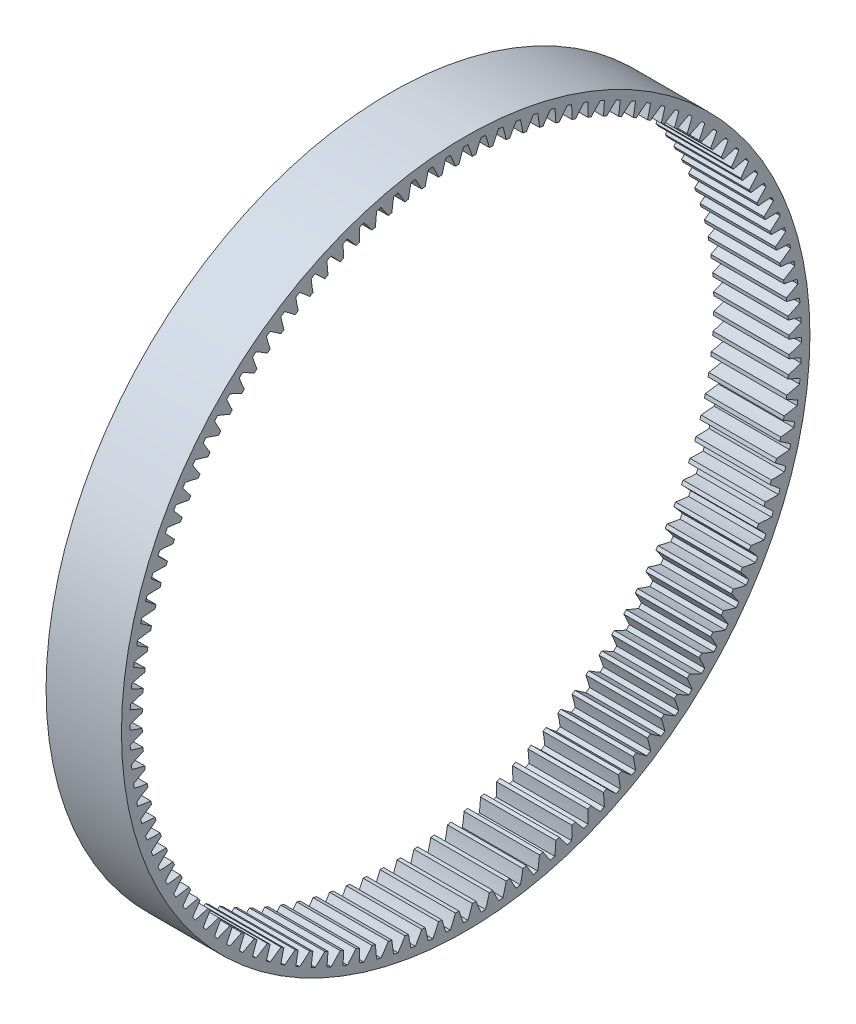
from build123d import *

# Parameters (mm, degrees)
BASPROSKE_W         = 6
BASPROSKE_H         = 2.2764
TOOTHCUT_DEPTH      = 87.865380871
TEETHCUTS_COUNT     = 120
TEETHCUTS_ANGLE     = 357
SKETCH1_R           = 62.7764
SKETCH1_R_2         = 61.2764
BOSS_EXTRUDE1_DEPTH = 6
SKETCH3_R           = 62.7764
BOSS_EXTRUDE2_DEPTH = 7.75


with BuildPart() as part:
    # BasProSke → Base-Revolve (revolve)
    with BuildSketch(Plane(origin=(0, 0, 0), x_dir=(1, 0, 0), z_dir=(0, 1, 0)), mode=Mode.PRIVATE) as base_revolve_sk:
        with Locations((3, 60.1382)):
            Rectangle(BASPROSKE_W, BASPROSKE_H)
    revolve(base_revolve_sk.sketch.rotate(Axis((-10, 0, 0), (1, 0, 0)), 180), axis=Axis((-10, 0, 0), (1, 0, 0)))

    # TooCutSke → ToothCut (cut, through all)
    with BuildSketch(Plane(origin=(0, 0, 0), x_dir=(0, 0, -1), z_dir=(1, 0, 0))):
        with BuildLine():
            ThreePointArc((1.222221041, 58.96193366), (0.837717971, 60.114045071), (0.406895219, 61.249648467))
            ThreePointArc((0.406895219, 61.249648467), (0, 61.251), (-0.406895219, 61.249648467))
            ThreePointArc((-0.406895219, 61.249648467), (-0.837717971, 60.114045071), (-1.222221041, 58.96193366))
            ThreePointArc((-1.222221041, 58.96193366), (0, 58.9746), (1.222221041, 58.96193366))
        make_face()
    toothcut = extrude(amount=TOOTHCUT_DEPTH, mode=Mode.SUBTRACT)

    # TeethCuts: ToothCut ×120 about axis
    teethcuts_axis = Axis((-10, 0, 0), (1, 0, 0))
    for i in range(1, TEETHCUTS_COUNT):
        add(toothcut.rotate(teethcuts_axis, i * TEETHCUTS_ANGLE / (TEETHCUTS_COUNT - 1)), mode=Mode.SUBTRACT)

    # Sketch1 → Boss-Extrude1 (add)
    with BuildSketch(Plane(origin=(6, 0, 0), x_dir=(0, 0, -1), z_dir=(1, 0, 0))):
        Circle(SKETCH1_R)
        Circle(SKETCH1_R_2, mode=Mode.SUBTRACT)
    extrude(amount=-BOSS_EXTRUDE1_DEPTH)

    # Sketch3 → Boss-Extrude2 (add)
    with BuildSketch(Plane.ZY):
        with Locations(Location((0, 0, 0), (0, 0, 180))):
            Circle(SKETCH3_R)
        with BuildLine():
            ThreePointArc((-1.874585183, 58.970212229), (-2.314708924, 60.0878651), (-2.799221339, 61.187003202))
            ThreePointArc((-2.799221339, 61.187003202), (-3.205629656, 61.167057633), (-3.611896506, 61.144412702))
            ThreePointArc((-3.611896506, 61.144412702), (-3.978863493, 60.000650455), (-4.299749654, 58.843114745))
            ThreePointArc((-4.299749654, 58.843114745), (-4.629086648, 58.81812269), (-4.958278576, 58.791287395))
            ThreePointArc((-4.958278576, 58.791287395), (-5.456292575, 59.884374265), (-5.997665425, 60.956648616))
            ThreePointArc((-5.997665425, 60.956648616), (-6.402472904, 60.915460613), (-6.806997835, 60.871584352))
            ThreePointArc((-6.806997835, 60.871584352), (-7.113602016, 59.710184023), (-7.373467675, 58.537440792))
            ThreePointArc((-7.373467675, 58.537440792), (-7.701045341, 58.495246821), (-8.028381672, 58.451219728))
            ThreePointArc((-8.028381672, 58.451219728), (-8.582920906, 59.516744521), (-9.179670328, 60.559216092))
            ThreePointArc((-9.179670328, 60.559216092), (-9.581767418, 60.49689855), (-9.983441656, 60.43191122))
            ThreePointArc((-9.983441656, 60.43191122), (-10.22884265, 59.256056127), (-10.426975533, 58.071319782))
            ThreePointArc((-10.426975533, 58.071319782), (-10.751896004, 58.012039546), (-11.076479532, 57.950941331))
            ThreePointArc((-11.076479532, 57.950941331), (-11.686024049, 58.985983519), (-12.336514392, 59.995794966))
            ThreePointArc((-12.336514392, 59.995794966), (-12.734798974, 59.912518693), (-13.132521557, 59.82659842))
            ThreePointArc((-13.132521557, 59.82659842), (-13.316046737, 58.6395115), (-13.451903777, 57.446029321))
            ThreePointArc((-13.451903777, 57.446029321), (-13.773276467, 57.369825303), (-14.094217532, 57.291823432))
            ThreePointArc((-14.094217532, 57.291823432), (-14.757096611, 58.293546035), (-15.459544928, 59.267929537))
            ThreePointArc((-15.459544928, 59.267929537), (-15.852925332, 59.163922786), (-16.24560613, 59.057305073))
            ThreePointArc((-16.24560613, 59.057305073), (-16.366752466, 57.862240049), (-16.439961287, 56.663283287))
            ThreePointArc((-16.439961287, 56.663283287), (-16.756905338, 56.570364357), (-17.073324261, 56.475672627))
            ThreePointArc((-17.073324261, 56.475672627), (-17.787720998, 57.441329994), (-18.540201926, 58.377614833))
            ThreePointArc((-18.540201926, 58.377614833), (-18.927599922, 58.25316268), (-19.314162625, 58.126139757))
            ThreePointArc((-19.314162625, 58.126139757), (-19.372598064, 56.926372219), (-19.382958006, 55.725227132))
            ThreePointArc((-19.382958006, 55.725227132), (-19.694604695, 55.615847974), (-20.005634195, 55.504725929))
            ThreePointArc((-20.005634195, 55.504725929), (-20.769590477, 56.431671259), (-21.570041519, 57.327291144))
            ThreePointArc((-21.570041519, 57.327291144), (-21.950395278, 57.182734703), (-22.329780344, 57.035654733))
            ThreePointArc((-22.329780344, 57.035654733), (-22.325344717, 55.834473159), (-22.272827385, 54.634432003))
            ThreePointArc((-22.272827385, 54.634432003), (-22.57832251, 54.508892418), (-22.883110076, 54.381644636))
            ThreePointArc((-22.883110076, 54.381644636), (-23.694531953, 55.267337237), (-24.540759128, 56.119837334))
            ThreePointArc((-24.540759128, 56.119837334), (-24.913026125, 55.955572826), (-25.284193686, 55.788838943))
            ThreePointArc((-25.284193686, 55.788838943), (-25.216899152, 54.58953569), (-25.101648492, 53.393887693))
            ThreePointArc((-25.101648492, 53.393887693), (-25.400154712, 53.252531777), (-25.697864943, 53.109507034))
            ThreePointArc((-25.697864943, 53.109507034), (-26.554528364, 53.951519284), (-27.444212221, 54.758562952))
            ThreePointArc((-27.444212221, 54.758562952), (-27.8073721, 54.575040613), (-28.169304811, 54.389109824))
            ThreePointArc((-28.169304811, 54.389109824), (-28.039335819, 53.194972098), (-27.861667725, 52.006994449))
            ThreePointArc((-27.861667725, 52.006994449), (-28.152366855, 51.850209647), (-28.442183748, 51.691799965))
            ThreePointArc((-28.442183748, 51.691799965), (-29.341740658, 52.487823968), (-30.272442637, 53.247199155))
            ThreePointArc((-30.272442637, 53.247199155), (-30.6255, 53.044922007), (-30.97720583, 52.840303935))
            ThreePointArc((-30.97720583, 52.840303935), (-30.784918616, 51.654604785), (-30.545320063, 50.477553648))
            ThreePointArc((-30.545320063, 50.477553648), (-30.827415318, 50.305769697), (-31.108544505, 50.132409266))
            ThreePointArc((-31.108544505, 50.132409266), (-32.048529281, 50.880263174), (-33.017698391, 51.589888485))
            ThreePointArc((-33.017698391, 51.589888485), (-33.359685534, 51.369410957), (-33.70020048, 51.146666446))
            ThreePointArc((-33.70020048, 51.146666446), (-33.446122091, 49.972655791), (-33.145249803, 48.80975738))
            ThreePointArc((-33.145249803, 48.80975738), (-33.417967979, 48.623445129), (-33.689638903, 48.435609117))
            ThreePointArc((-33.689638903, 48.435609117), (-34.667475112, 49.133243116), (-35.672454929, 49.791173518))
            ThreePointArc((-35.672454929, 49.791173518), (-36.002434488, 49.553099922), (-36.330825224, 49.3128395))
            ThreePointArc((-36.330825224, 49.3128395), (-36.01565207, 48.153735221), (-35.654330716, 47.008176961))
            ThreePointArc((-35.654330716, 47.008176961), (-35.916924312, 46.807847077), (-36.178392344, 46.606050331))
            ThreePointArc((-36.178392344, 46.606050331), (-37.191399804, 47.251552253), (-38.229435748, 47.855984405))
            ThreePointArc((-38.229435748, 47.855984405), (-38.546503272, 47.600967285), (-38.861869701, 47.343849488))
            ThreePointArc((-38.861869701, 47.343849488), (-38.48646565, 46.202828609), (-38.065685588, 45.077750396))
            ThreePointArc((-38.065685588, 45.077750396), (-38.317434851, 44.86395197), (-38.567983325, 44.6487476))
            ThreePointArc((-38.567983325, 44.6487476), (-39.613385455, 45.24034817), (-40.681632341, 45.789625365))
            ThreePointArc((-40.681632341, 45.789625365), (-40.98491877, 45.518363705), (-41.286396494, 45.245093275))
            ThreePointArc((-41.286396494, 45.245093275), (-40.851790503, 44.125283256), (-40.372705061, 43.02376885))
            ThreePointArc((-40.372705061, 43.02376885), (-40.612919966, 42.79708789), (-40.851862145, 42.569065755))
            ThreePointArc((-40.851862145, 42.569065755), (-41.926793569, 43.105143437), (-43.022323407, 43.597760145))
            ThreePointArc((-43.022323407, 43.597760145), (-43.310997454, 43.310997454), (-43.597760145, 43.022323407))
            ThreePointArc((-43.597760145, 43.022323407), (-43.105143437, 41.926793569), (-42.569065755, 40.851862145))
            ThreePointArc((-42.569065755, 40.851862145), (-42.79708789, 40.612919966), (-43.02376885, 40.372705061))
            ThreePointArc((-43.02376885, 40.372705061), (-44.125283256, 40.851790503), (-45.245093275, 41.286396494))
            ThreePointArc((-45.245093275, 41.286396494), (-45.518363705, 40.98491877), (-45.789625365, 40.681632341))
            ThreePointArc((-45.789625365, 40.681632341), (-45.24034817, 39.613385455), (-44.6487476, 38.567983325))
            ThreePointArc((-44.6487476, 38.567983325), (-44.86395197, 38.317434851), (-45.077750396, 38.065685588))
            ThreePointArc((-45.077750396, 38.065685588), (-46.202828609, 38.48646565), (-47.343849488, 38.861869701))
            ThreePointArc((-47.343849488, 38.861869701), (-47.600967285, 38.546503272), (-47.855984405, 38.229435748))
            ThreePointArc((-47.855984405, 38.229435748), (-47.251552253, 37.191399804), (-46.606050331, 36.178392344))
            ThreePointArc((-46.606050331, 36.178392344), (-46.807847077, 35.916924312), (-47.008176961, 35.654330716))
            ThreePointArc((-47.008176961, 35.654330716), (-48.153735221, 36.01565207), (-49.3128395, 36.330825224))
            ThreePointArc((-49.3128395, 36.330825224), (-49.553099922, 36.002434488), (-49.791173518, 35.672454929))
            ThreePointArc((-49.791173518, 35.672454929), (-49.133243116, 34.667475112), (-48.435609117, 33.689638903))
            ThreePointArc((-48.435609117, 33.689638903), (-48.623445129, 33.417967979), (-48.80975738, 33.145249803))
            ThreePointArc((-48.80975738, 33.145249803), (-49.972655791, 33.446122091), (-51.146666446, 33.70020048))
            ThreePointArc((-51.146666446, 33.70020048), (-51.369410957, 33.359685534), (-51.589888485, 33.017698391))
            ThreePointArc((-51.589888485, 33.017698391), (-50.880263174, 32.048529281), (-50.132409266, 31.108544505))
            ThreePointArc((-50.132409266, 31.108544505), (-50.305769697, 30.827415318), (-50.477553648, 30.545320063))
            ThreePointArc((-50.477553648, 30.545320063), (-51.654604785, 30.784918616), (-52.840303935, 30.97720583))
            ThreePointArc((-52.840303935, 30.97720583), (-53.044922007, 30.6255), (-53.247199155, 30.272442637))
            ThreePointArc((-53.247199155, 30.272442637), (-52.487823968, 29.341740658), (-51.691799965, 28.442183748))
            ThreePointArc((-51.691799965, 28.442183748), (-51.850209647, 28.152366855), (-52.006994449, 27.861667725))
            ThreePointArc((-52.006994449, 27.861667725), (-53.194972098, 28.039335819), (-54.389109824, 28.169304811))
            ThreePointArc((-54.389109824, 28.169304811), (-54.575040613, 27.8073721), (-54.758562952, 27.444212221))
            ThreePointArc((-54.758562952, 27.444212221), (-53.951519284, 26.554528364), (-53.109507034, 25.697864943))
            ThreePointArc((-53.109507034, 25.697864943), (-53.252531777, 25.400154712), (-53.393887693, 25.101648492))
            ThreePointArc((-53.393887693, 25.101648492), (-54.58953569, 25.216899152), (-55.788838943, 25.284193686))
            ThreePointArc((-55.788838943, 25.284193686), (-55.955572826, 24.913026125), (-56.119837334, 24.540759128))
            ThreePointArc((-56.119837334, 24.540759128), (-55.267337237, 23.694531953), (-54.381644636, 22.883110076))
            ThreePointArc((-54.381644636, 22.883110076), (-54.508892418, 22.57832251), (-54.634432003, 22.272827385))
            ThreePointArc((-54.634432003, 22.272827385), (-55.834473159, 22.325344717), (-57.035654733, 22.329780344))
            ThreePointArc((-57.035654733, 22.329780344), (-57.182734703, 21.950395278), (-57.327291144, 21.570041519))
            ThreePointArc((-57.327291144, 21.570041519), (-56.431671259, 20.769590477), (-55.504725929, 20.005634195))
            ThreePointArc((-55.504725929, 20.005634195), (-55.615847974, 19.694604695), (-55.725227132, 19.382958006))
            ThreePointArc((-55.725227132, 19.382958006), (-56.926372219, 19.372598064), (-58.126139757, 19.314162625))
            ThreePointArc((-58.126139757, 19.314162625), (-58.25316268, 18.927599922), (-58.377614833, 18.540201926))
            ThreePointArc((-58.377614833, 18.540201926), (-57.441329994, 17.787720998), (-56.475672627, 17.073324261))
            ThreePointArc((-56.475672627, 17.073324261), (-56.570364357, 16.756905338), (-56.663283287, 16.439961287))
            ThreePointArc((-56.663283287, 16.439961287), (-57.862240049, 16.366752466), (-59.057305073, 16.24560613))
            ThreePointArc((-59.057305073, 16.24560613), (-59.163922786, 15.852925332), (-59.267929537, 15.459544928))
            ThreePointArc((-59.267929537, 15.459544928), (-58.293546035, 14.757096611), (-57.291823432, 14.094217532))
            ThreePointArc((-57.291823432, 14.094217532), (-57.369825303, 13.773276467), (-57.446029321, 13.451903777))
            ThreePointArc((-57.446029321, 13.451903777), (-58.6395115, 13.316046737), (-59.82659842, 13.132521557))
            ThreePointArc((-59.82659842, 13.132521557), (-59.912518693, 12.734798974), (-59.995794966, 12.336514392))
            ThreePointArc((-59.995794966, 12.336514392), (-58.985983519, 11.686024049), (-57.950941331, 11.076479532))
            ThreePointArc((-57.950941331, 11.076479532), (-58.012039546, 10.751896004), (-58.071319782, 10.426975533))
            ThreePointArc((-58.071319782, 10.426975533), (-59.256056127, 10.22884265), (-60.43191122, 9.983441656))
            ThreePointArc((-60.43191122, 9.983441656), (-60.49689855, 9.581767418), (-60.559216092, 9.179670328))
            ThreePointArc((-60.559216092, 9.179670328), (-59.516744521, 8.582920906), (-58.451219728, 8.028381672))
            ThreePointArc((-58.451219728, 8.028381672), (-58.495246821, 7.701045341), (-58.537440792, 7.373467675))
            ThreePointArc((-58.537440792, 7.373467675), (-59.710184023, 7.113602016), (-60.871584352, 6.806997835))
            ThreePointArc((-60.871584352, 6.806997835), (-60.915460613, 6.402472904), (-60.956648616, 5.997665425))
            ThreePointArc((-60.956648616, 5.997665425), (-59.884374265, 5.456292575), (-58.791287395, 4.958278576))
            ThreePointArc((-58.791287395, 4.958278576), (-58.81812269, 4.629086648), (-58.843114745, 4.299749654))
            ThreePointArc((-58.843114745, 4.299749654), (-60.000650455, 3.978863493), (-61.144412702, 3.611896506))
            ThreePointArc((-61.144412702, 3.611896506), (-61.167057633, 3.205629656), (-61.187003202, 2.799221339))
            ThreePointArc((-61.187003202, 2.799221339), (-60.0878651, 2.314708924), (-58.970212229, 1.874585183))
            ThreePointArc((-58.970212229, 1.874585183), (-58.979782174, 1.54443995), (-58.987503811, 1.214246318))
            ThreePointArc((-58.987503811, 1.214246318), (-60.126659275, 0.833219183), (-61.249648467, 0.406895219))
            ThreePointArc((-61.249648467, 0.406895219), (-61.251, 0), (-61.249648467, -0.406895219))
            ThreePointArc((-61.249648467, -0.406895219), (-60.126659275, -0.833219183), (-58.987503811, -1.214246318))
            ThreePointArc((-58.987503811, -1.214246318), (-58.979782174, -1.54443995), (-58.970212229, -1.874585183))
            ThreePointArc((-58.970212229, -1.874585183), (-60.0878651, -2.314708924), (-61.187003202, -2.799221339))
            ThreePointArc((-61.187003202, -2.799221339), (-61.167057633, -3.205629656), (-61.144412702, -3.611896506))
            ThreePointArc((-61.144412702, -3.611896506), (-60.000650455, -3.978863493), (-58.843114745, -4.299749654))
            ThreePointArc((-58.843114745, -4.299749654), (-58.81812269, -4.629086648), (-58.791287395, -4.958278576))
            ThreePointArc((-58.791287395, -4.958278576), (-59.884374265, -5.456292575), (-60.956648616, -5.997665425))
            ThreePointArc((-60.956648616, -5.997665425), (-60.915460613, -6.402472904), (-60.871584352, -6.806997835))
            ThreePointArc((-60.871584352, -6.806997835), (-59.710184023, -7.113602016), (-58.537440792, -7.373467675))
            ThreePointArc((-58.537440792, -7.373467675), (-58.495246821, -7.701045341), (-58.451219728, -8.028381672))
            ThreePointArc((-58.451219728, -8.028381672), (-59.516744521, -8.582920906), (-60.559216092, -9.179670328))
            ThreePointArc((-60.559216092, -9.179670328), (-60.49689855, -9.581767418), (-60.43191122, -9.983441656))
            ThreePointArc((-60.43191122, -9.983441656), (-59.256056127, -10.22884265), (-58.071319782, -10.426975533))
            ThreePointArc((-58.071319782, -10.426975533), (-58.012039546, -10.751896004), (-57.950941331, -11.076479532))
            ThreePointArc((-57.950941331, -11.076479532), (-58.985983519, -11.686024049), (-59.995794966, -12.336514392))
            ThreePointArc((-59.995794966, -12.336514392), (-59.912518693, -12.734798974), (-59.82659842, -13.132521557))
            ThreePointArc((-59.82659842, -13.132521557), (-58.6395115, -13.316046737), (-57.446029321, -13.451903777))
            ThreePointArc((-57.446029321, -13.451903777), (-57.369825303, -13.773276467), (-57.291823432, -14.094217532))
            ThreePointArc((-57.291823432, -14.094217532), (-58.293546035, -14.757096611), (-59.267929537, -15.459544928))
            ThreePointArc((-59.267929537, -15.459544928), (-59.163922786, -15.852925332), (-59.057305073, -16.24560613))
            ThreePointArc((-59.057305073, -16.24560613), (-57.862240049, -16.366752466), (-56.663283287, -16.439961287))
            ThreePointArc((-56.663283287, -16.439961287), (-56.570364357, -16.756905338), (-56.475672627, -17.073324261))
            ThreePointArc((-56.475672627, -17.073324261), (-57.441329994, -17.787720998), (-58.377614833, -18.540201926))
            ThreePointArc((-58.377614833, -18.540201926), (-58.25316268, -18.927599922), (-58.126139757, -19.314162625))
            ThreePointArc((-58.126139757, -19.314162625), (-56.926372219, -19.372598064), (-55.725227132, -19.382958006))
            ThreePointArc((-55.725227132, -19.382958006), (-55.615847974, -19.694604695), (-55.504725929, -20.005634195))
            ThreePointArc((-55.504725929, -20.005634195), (-56.431671259, -20.769590477), (-57.327291144, -21.570041519))
            ThreePointArc((-57.327291144, -21.570041519), (-57.182734703, -21.950395278), (-57.035654733, -22.329780344))
            ThreePointArc((-57.035654733, -22.329780344), (-55.834473159, -22.325344717), (-54.634432003, -22.272827385))
            ThreePointArc((-54.634432003, -22.272827385), (-54.508892418, -22.57832251), (-54.381644636, -22.883110076))
            ThreePointArc((-54.381644636, -22.883110076), (-55.267337237, -23.694531953), (-56.119837334, -24.540759128))
            ThreePointArc((-56.119837334, -24.540759128), (-55.955572826, -24.913026125), (-55.788838943, -25.284193686))
            ThreePointArc((-55.788838943, -25.284193686), (-54.58953569, -25.216899152), (-53.393887693, -25.101648492))
            ThreePointArc((-53.393887693, -25.101648492), (-53.252531777, -25.400154712), (-53.109507034, -25.697864943))
            ThreePointArc((-53.109507034, -25.697864943), (-53.951519284, -26.554528364), (-54.758562952, -27.444212221))
            ThreePointArc((-54.758562952, -27.444212221), (-54.575040613, -27.8073721), (-54.389109824, -28.169304811))
            ThreePointArc((-54.389109824, -28.169304811), (-53.194972098, -28.039335819), (-52.006994449, -27.861667725))
            ThreePointArc((-52.006994449, -27.861667725), (-51.850209647, -28.152366855), (-51.691799965, -28.442183748))
            ThreePointArc((-51.691799965, -28.442183748), (-52.487823968, -29.341740658), (-53.247199155, -30.272442637))
            ThreePointArc((-53.247199155, -30.272442637), (-53.044922007, -30.6255), (-52.840303935, -30.97720583))
            ThreePointArc((-52.840303935, -30.97720583), (-51.654604785, -30.784918616), (-50.477553648, -30.545320063))
            ThreePointArc((-50.477553648, -30.545320063), (-50.305769697, -30.827415318), (-50.132409266, -31.108544505))
            ThreePointArc((-50.132409266, -31.108544505), (-50.880263174, -32.048529281), (-51.589888485, -33.017698391))
            ThreePointArc((-51.589888485, -33.017698391), (-51.369410957, -33.359685534), (-51.146666446, -33.70020048))
            ThreePointArc((-51.146666446, -33.70020048), (-49.972655791, -33.446122091), (-48.80975738, -33.145249803))
            ThreePointArc((-48.80975738, -33.145249803), (-48.623445129, -33.417967979), (-48.435609117, -33.689638903))
            ThreePointArc((-48.435609117, -33.689638903), (-49.133243116, -34.667475112), (-49.791173518, -35.672454929))
            ThreePointArc((-49.791173518, -35.672454929), (-49.553099922, -36.002434488), (-49.3128395, -36.330825224))
            ThreePointArc((-49.3128395, -36.330825224), (-48.153735221, -36.01565207), (-47.008176961, -35.654330716))
            ThreePointArc((-47.008176961, -35.654330716), (-46.807847077, -35.916924312), (-46.606050331, -36.178392344))
            ThreePointArc((-46.606050331, -36.178392344), (-47.251552253, -37.191399804), (-47.855984405, -38.229435748))
            ThreePointArc((-47.855984405, -38.229435748), (-47.600967285, -38.546503272), (-47.343849488, -38.861869701))
            ThreePointArc((-47.343849488, -38.861869701), (-46.202828609, -38.48646565), (-45.077750396, -38.065685588))
            ThreePointArc((-45.077750396, -38.065685588), (-44.86395197, -38.317434851), (-44.6487476, -38.567983325))
            ThreePointArc((-44.6487476, -38.567983325), (-45.24034817, -39.613385455), (-45.789625365, -40.681632341))
            ThreePointArc((-45.789625365, -40.681632341), (-45.518363705, -40.98491877), (-45.245093275, -41.286396494))
            ThreePointArc((-45.245093275, -41.286396494), (-44.125283256, -40.851790503), (-43.02376885, -40.372705061))
            ThreePointArc((-43.02376885, -40.372705061), (-42.79708789, -40.612919966), (-42.569065755, -40.851862145))
            ThreePointArc((-42.569065755, -40.851862145), (-43.105143437, -41.926793569), (-43.597760145, -43.022323407))
            ThreePointArc((-43.597760145, -43.022323407), (-43.310997454, -43.310997454), (-43.022323407, -43.597760145))
            ThreePointArc((-43.022323407, -43.597760145), (-41.926793569, -43.105143437), (-40.851862145, -42.569065755))
            ThreePointArc((-40.851862145, -42.569065755), (-40.612919966, -42.79708789), (-40.372705061, -43.02376885))
            ThreePointArc((-40.372705061, -43.02376885), (-40.851790503, -44.125283256), (-41.286396494, -45.245093275))
            ThreePointArc((-41.286396494, -45.245093275), (-40.98491877, -45.518363705), (-40.681632341, -45.789625365))
            ThreePointArc((-40.681632341, -45.789625365), (-39.613385455, -45.24034817), (-38.567983325, -44.6487476))
            ThreePointArc((-38.567983325, -44.6487476), (-38.317434851, -44.86395197), (-38.065685588, -45.077750396))
            ThreePointArc((-38.065685588, -45.077750396), (-38.48646565, -46.202828609), (-38.861869701, -47.343849488))
            ThreePointArc((-38.861869701, -47.343849488), (-38.546503272, -47.600967285), (-38.229435748, -47.855984405))
            ThreePointArc((-38.229435748, -47.855984405), (-37.191399804, -47.251552253), (-36.178392344, -46.606050331))
            ThreePointArc((-36.178392344, -46.606050331), (-35.916924312, -46.807847077), (-35.654330716, -47.008176961))
            ThreePointArc((-35.654330716, -47.008176961), (-36.01565207, -48.153735221), (-36.330825224, -49.3128395))
            ThreePointArc((-36.330825224, -49.3128395), (-36.002434488, -49.553099922), (-35.672454929, -49.791173518))
            ThreePointArc((-35.672454929, -49.791173518), (-34.667475112, -49.133243116), (-33.689638903, -48.435609117))
            ThreePointArc((-33.689638903, -48.435609117), (-33.417967979, -48.623445129), (-33.145249803, -48.80975738))
            ThreePointArc((-33.145249803, -48.80975738), (-33.446122091, -49.972655791), (-33.70020048, -51.146666446))
            ThreePointArc((-33.70020048, -51.146666446), (-33.359685534, -51.369410957), (-33.017698391, -51.589888485))
            ThreePointArc((-33.017698391, -51.589888485), (-32.048529281, -50.880263174), (-31.108544505, -50.132409266))
            ThreePointArc((-31.108544505, -50.132409266), (-30.827415318, -50.305769697), (-30.545320063, -50.477553648))
            ThreePointArc((-30.545320063, -50.477553648), (-30.784918616, -51.654604785), (-30.97720583, -52.840303935))
            ThreePointArc((-30.97720583, -52.840303935), (-30.6255, -53.044922007), (-30.272442637, -53.247199155))
            ThreePointArc((-30.272442637, -53.247199155), (-29.341740658, -52.487823968), (-28.442183748, -51.691799965))
            ThreePointArc((-28.442183748, -51.691799965), (-28.152366855, -51.850209647), (-27.861667725, -52.006994449))
            ThreePointArc((-27.861667725, -52.006994449), (-28.039335819, -53.194972098), (-28.169304811, -54.389109824))
            ThreePointArc((-28.169304811, -54.389109824), (-27.8073721, -54.575040613), (-27.444212221, -54.758562952))
            ThreePointArc((-27.444212221, -54.758562952), (-26.554528364, -53.951519284), (-25.697864943, -53.109507034))
            ThreePointArc((-25.697864943, -53.109507034), (-25.400154712, -53.252531777), (-25.101648492, -53.393887693))
            ThreePointArc((-25.101648492, -53.393887693), (-25.216899152, -54.58953569), (-25.284193686, -55.788838943))
            ThreePointArc((-25.284193686, -55.788838943), (-24.913026125, -55.955572826), (-24.540759128, -56.119837334))
            ThreePointArc((-24.540759128, -56.119837334), (-23.694531953, -55.267337237), (-22.883110076, -54.381644636))
            ThreePointArc((-22.883110076, -54.381644636), (-22.57832251, -54.508892418), (-22.272827385, -54.634432003))
            ThreePointArc((-22.272827385, -54.634432003), (-22.325344717, -55.834473159), (-22.329780344, -57.035654733))
            ThreePointArc((-22.329780344, -57.035654733), (-21.950395278, -57.182734703), (-21.570041519, -57.327291144))
            ThreePointArc((-21.570041519, -57.327291144), (-20.769590477, -56.431671259), (-20.005634195, -55.504725929))
            ThreePointArc((-20.005634195, -55.504725929), (-19.694604695, -55.615847974), (-19.382958006, -55.725227132))
            ThreePointArc((-19.382958006, -55.725227132), (-19.372598064, -56.926372219), (-19.314162625, -58.126139757))
            ThreePointArc((-19.314162625, -58.126139757), (-18.927599922, -58.25316268), (-18.540201926, -58.377614833))
            ThreePointArc((-18.540201926, -58.377614833), (-17.787720998, -57.441329994), (-17.073324261, -56.475672627))
            ThreePointArc((-17.073324261, -56.475672627), (-16.756905338, -56.570364357), (-16.439961287, -56.663283287))
            ThreePointArc((-16.439961287, -56.663283287), (-16.366752466, -57.862240049), (-16.24560613, -59.057305073))
            ThreePointArc((-16.24560613, -59.057305073), (-15.852925332, -59.163922786), (-15.459544928, -59.267929537))
            ThreePointArc((-15.459544928, -59.267929537), (-14.757096611, -58.293546035), (-14.094217532, -57.291823432))
            ThreePointArc((-14.094217532, -57.291823432), (-13.773276467, -57.369825303), (-13.451903777, -57.446029321))
            ThreePointArc((-13.451903777, -57.446029321), (-13.316046737, -58.6395115), (-13.132521557, -59.82659842))
            ThreePointArc((-13.132521557, -59.82659842), (-12.734798974, -59.912518693), (-12.336514392, -59.995794966))
            ThreePointArc((-12.336514392, -59.995794966), (-11.686024049, -58.985983519), (-11.076479532, -57.950941331))
            ThreePointArc((-11.076479532, -57.950941331), (-10.751896004, -58.012039546), (-10.426975533, -58.071319782))
            ThreePointArc((-10.426975533, -58.071319782), (-10.22884265, -59.256056127), (-9.983441656, -60.43191122))
            ThreePointArc((-9.983441656, -60.43191122), (-9.581767418, -60.49689855), (-9.179670328, -60.559216092))
            ThreePointArc((-9.179670328, -60.559216092), (-8.582920906, -59.516744521), (-8.028381672, -58.451219728))
            ThreePointArc((-8.028381672, -58.451219728), (-7.701045341, -58.495246821), (-7.373467675, -58.537440792))
            ThreePointArc((-7.373467675, -58.537440792), (-7.113602016, -59.710184023), (-6.806997835, -60.871584352))
            ThreePointArc((-6.806997835, -60.871584352), (-6.402472904, -60.915460613), (-5.997665425, -60.956648616))
            ThreePointArc((-5.997665425, -60.956648616), (-5.456292575, -59.884374265), (-4.958278576, -58.791287395))
            ThreePointArc((-4.958278576, -58.791287395), (-4.629086648, -58.81812269), (-4.299749654, -58.843114745))
            ThreePointArc((-4.299749654, -58.843114745), (-3.978863493, -60.000650455), (-3.611896506, -61.144412702))
            ThreePointArc((-3.611896506, -61.144412702), (-3.205629656, -61.167057633), (-2.799221339, -61.187003202))
            ThreePointArc((-2.799221339, -61.187003202), (-2.314708924, -60.0878651), (-1.874585183, -58.970212229))
            ThreePointArc((-1.874585183, -58.970212229), (-1.54443995, -58.979782174), (-1.214246318, -58.987503811))
            ThreePointArc((-1.214246318, -58.987503811), (-0.833219183, -60.126659275), (-0.406895219, -61.249648467))
            ThreePointArc((-0.406895219, -61.249648467), (0, -61.251), (0.406895219, -61.249648467))
            ThreePointArc((0.406895219, -61.249648467), (0.833219183, -60.126659275), (1.214246318, -58.987503811))
            ThreePointArc((1.214246318, -58.987503811), (1.54443995, -58.979782174), (1.874585183, -58.970212229))
            ThreePointArc((1.874585183, -58.970212229), (2.314708924, -60.0878651), (2.799221339, -61.187003202))
            ThreePointArc((2.799221339, -61.187003202), (3.205629656, -61.167057633), (3.611896506, -61.144412702))
            ThreePointArc((3.611896506, -61.144412702), (3.978863493, -60.000650455), (4.299749654, -58.843114745))
            ThreePointArc((4.299749654, -58.843114745), (4.629086648, -58.81812269), (4.958278576, -58.791287395))
            ThreePointArc((4.958278576, -58.791287395), (5.456292575, -59.884374265), (5.997665425, -60.956648616))
            ThreePointArc((5.997665425, -60.956648616), (6.402472904, -60.915460613), (6.806997835, -60.871584352))
            ThreePointArc((6.806997835, -60.871584352), (7.113602016, -59.710184023), (7.373467675, -58.537440792))
            ThreePointArc((7.373467675, -58.537440792), (7.701045341, -58.495246821), (8.028381672, -58.451219728))
            ThreePointArc((8.028381672, -58.451219728), (8.582920906, -59.516744521), (9.179670328, -60.559216092))
            ThreePointArc((9.179670328, -60.559216092), (9.581767418, -60.49689855), (9.983441656, -60.43191122))
            ThreePointArc((9.983441656, -60.43191122), (10.22884265, -59.256056127), (10.426975533, -58.071319782))
            ThreePointArc((10.426975533, -58.071319782), (10.751896004, -58.012039546), (11.076479532, -57.950941331))
            ThreePointArc((11.076479532, -57.950941331), (11.686024049, -58.985983519), (12.336514392, -59.995794966))
            ThreePointArc((12.336514392, -59.995794966), (12.734798974, -59.912518693), (13.132521557, -59.82659842))
            ThreePointArc((13.132521557, -59.82659842), (13.316046737, -58.6395115), (13.451903777, -57.446029321))
            ThreePointArc((13.451903777, -57.446029321), (13.773276467, -57.369825303), (14.094217532, -57.291823432))
            ThreePointArc((14.094217532, -57.291823432), (14.757096611, -58.293546035), (15.459544928, -59.267929537))
            ThreePointArc((15.459544928, -59.267929537), (15.852925332, -59.163922786), (16.24560613, -59.057305073))
            ThreePointArc((16.24560613, -59.057305073), (16.366752466, -57.862240049), (16.439961287, -56.663283287))
            ThreePointArc((16.439961287, -56.663283287), (16.756905338, -56.570364357), (17.073324261, -56.475672627))
            ThreePointArc((17.073324261, -56.475672627), (17.787720998, -57.441329994), (18.540201926, -58.377614833))
            ThreePointArc((18.540201926, -58.377614833), (18.927599922, -58.25316268), (19.314162625, -58.126139757))
            ThreePointArc((19.314162625, -58.126139757), (19.372598064, -56.926372219), (19.382958006, -55.725227132))
            ThreePointArc((19.382958006, -55.725227132), (19.694604695, -55.615847974), (20.005634195, -55.504725929))
            ThreePointArc((20.005634195, -55.504725929), (20.769590477, -56.431671259), (21.570041519, -57.327291144))
            ThreePointArc((21.570041519, -57.327291144), (21.950395278, -57.182734703), (22.329780344, -57.035654733))
            ThreePointArc((22.329780344, -57.035654733), (22.325344717, -55.834473159), (22.272827385, -54.634432003))
            ThreePointArc((22.272827385, -54.634432003), (22.57832251, -54.508892418), (22.883110076, -54.381644636))
            ThreePointArc((22.883110076, -54.381644636), (23.694531953, -55.267337237), (24.540759128, -56.119837334))
            ThreePointArc((24.540759128, -56.119837334), (24.913026125, -55.955572826), (25.284193686, -55.788838943))
            ThreePointArc((25.284193686, -55.788838943), (25.216899152, -54.58953569), (25.101648492, -53.393887693))
            ThreePointArc((25.101648492, -53.393887693), (25.400154712, -53.252531777), (25.697864943, -53.109507034))
            ThreePointArc((25.697864943, -53.109507034), (26.554528364, -53.951519284), (27.444212221, -54.758562952))
            ThreePointArc((27.444212221, -54.758562952), (27.8073721, -54.575040613), (28.169304811, -54.389109824))
            ThreePointArc((28.169304811, -54.389109824), (28.039335819, -53.194972098), (27.861667725, -52.006994449))
            ThreePointArc((27.861667725, -52.006994449), (28.152366855, -51.850209647), (28.442183748, -51.691799965))
            ThreePointArc((28.442183748, -51.691799965), (29.341740658, -52.487823968), (30.272442637, -53.247199155))
            ThreePointArc((30.272442637, -53.247199155), (30.6255, -53.044922007), (30.97720583, -52.840303935))
            ThreePointArc((30.97720583, -52.840303935), (30.784918616, -51.654604785), (30.545320063, -50.477553648))
            ThreePointArc((30.545320063, -50.477553648), (30.827415318, -50.305769697), (31.108544505, -50.132409266))
            ThreePointArc((31.108544505, -50.132409266), (32.048529281, -50.880263174), (33.017698391, -51.589888485))
            ThreePointArc((33.017698391, -51.589888485), (33.359685534, -51.369410957), (33.70020048, -51.146666446))
            ThreePointArc((33.70020048, -51.146666446), (33.446122091, -49.972655791), (33.145249803, -48.80975738))
            ThreePointArc((33.145249803, -48.80975738), (33.417967979, -48.623445129), (33.689638903, -48.435609117))
            ThreePointArc((33.689638903, -48.435609117), (34.667475112, -49.133243116), (35.672454929, -49.791173518))
            ThreePointArc((35.672454929, -49.791173518), (36.002434488, -49.553099922), (36.330825224, -49.3128395))
            ThreePointArc((36.330825224, -49.3128395), (36.01565207, -48.153735221), (35.654330716, -47.008176961))
            ThreePointArc((35.654330716, -47.008176961), (35.916924312, -46.807847077), (36.178392344, -46.606050331))
            ThreePointArc((36.178392344, -46.606050331), (37.191399804, -47.251552253), (38.229435748, -47.855984405))
            ThreePointArc((38.229435748, -47.855984405), (38.546503272, -47.600967285), (38.861869701, -47.343849488))
            ThreePointArc((38.861869701, -47.343849488), (38.48646565, -46.202828609), (38.065685588, -45.077750396))
            ThreePointArc((38.065685588, -45.077750396), (38.317434851, -44.86395197), (38.567983325, -44.6487476))
            ThreePointArc((38.567983325, -44.6487476), (39.613385455, -45.24034817), (40.681632341, -45.789625365))
            ThreePointArc((40.681632341, -45.789625365), (40.98491877, -45.518363705), (41.286396494, -45.245093275))
            ThreePointArc((41.286396494, -45.245093275), (40.851790503, -44.125283256), (40.372705061, -43.02376885))
            ThreePointArc((40.372705061, -43.02376885), (40.612919966, -42.79708789), (40.851862145, -42.569065755))
            ThreePointArc((40.851862145, -42.569065755), (41.926793569, -43.105143437), (43.022323407, -43.597760145))
            ThreePointArc((43.022323407, -43.597760145), (43.310997454, -43.310997454), (43.597760145, -43.022323407))
            ThreePointArc((43.597760145, -43.022323407), (43.105143437, -41.926793569), (42.569065755, -40.851862145))
            ThreePointArc((42.569065755, -40.851862145), (42.79708789, -40.612919966), (43.02376885, -40.372705061))
            ThreePointArc((43.02376885, -40.372705061), (44.125283256, -40.851790503), (45.245093275, -41.286396494))
            ThreePointArc((45.245093275, -41.286396494), (45.518363705, -40.98491877), (45.789625365, -40.681632341))
            ThreePointArc((45.789625365, -40.681632341), (45.24034817, -39.613385455), (44.6487476, -38.567983325))
            ThreePointArc((44.6487476, -38.567983325), (44.86395197, -38.317434851), (45.077750396, -38.065685588))
            ThreePointArc((45.077750396, -38.065685588), (46.202828609, -38.48646565), (47.343849488, -38.861869701))
            ThreePointArc((47.343849488, -38.861869701), (47.600967285, -38.546503272), (47.855984405, -38.229435748))
            ThreePointArc((47.855984405, -38.229435748), (47.251552253, -37.191399804), (46.606050331, -36.178392344))
            ThreePointArc((46.606050331, -36.178392344), (46.807847077, -35.916924312), (47.008176961, -35.654330716))
            ThreePointArc((47.008176961, -35.654330716), (48.153735221, -36.01565207), (49.3128395, -36.330825224))
            ThreePointArc((49.3128395, -36.330825224), (49.553099922, -36.002434488), (49.791173518, -35.672454929))
            ThreePointArc((49.791173518, -35.672454929), (49.133243116, -34.667475112), (48.435609117, -33.689638903))
            ThreePointArc((48.435609117, -33.689638903), (48.623445129, -33.417967979), (48.80975738, -33.145249803))
            ThreePointArc((48.80975738, -33.145249803), (49.972655791, -33.446122091), (51.146666446, -33.70020048))
            ThreePointArc((51.146666446, -33.70020048), (51.369410957, -33.359685534), (51.589888485, -33.017698391))
            ThreePointArc((51.589888485, -33.017698391), (50.880263174, -32.048529281), (50.132409266, -31.108544505))
            ThreePointArc((50.132409266, -31.108544505), (50.305769697, -30.827415318), (50.477553648, -30.545320063))
            ThreePointArc((50.477553648, -30.545320063), (51.654604785, -30.784918616), (52.840303935, -30.97720583))
            ThreePointArc((52.840303935, -30.97720583), (53.044922007, -30.6255), (53.247199155, -30.272442637))
            ThreePointArc((53.247199155, -30.272442637), (52.487823968, -29.341740658), (51.691799965, -28.442183748))
            ThreePointArc((51.691799965, -28.442183748), (51.850209647, -28.152366855), (52.006994449, -27.861667725))
            ThreePointArc((52.006994449, -27.861667725), (53.194972098, -28.039335819), (54.389109824, -28.169304811))
            ThreePointArc((54.389109824, -28.169304811), (54.575040613, -27.8073721), (54.758562952, -27.444212221))
            ThreePointArc((54.758562952, -27.444212221), (53.951519284, -26.554528364), (53.109507034, -25.697864943))
            ThreePointArc((53.109507034, -25.697864943), (53.252531777, -25.400154712), (53.393887693, -25.101648492))
            ThreePointArc((53.393887693, -25.101648492), (54.58953569, -25.216899152), (55.788838943, -25.284193686))
            ThreePointArc((55.788838943, -25.284193686), (55.955572826, -24.913026125), (56.119837334, -24.540759128))
            ThreePointArc((56.119837334, -24.540759128), (55.267337237, -23.694531953), (54.381644636, -22.883110076))
            ThreePointArc((54.381644636, -22.883110076), (54.508892418, -22.57832251), (54.634432003, -22.272827385))
            ThreePointArc((54.634432003, -22.272827385), (55.834473159, -22.325344717), (57.035654733, -22.329780344))
            ThreePointArc((57.035654733, -22.329780344), (57.182734703, -21.950395278), (57.327291144, -21.570041519))
            ThreePointArc((57.327291144, -21.570041519), (56.431671259, -20.769590477), (55.504725929, -20.005634195))
            ThreePointArc((55.504725929, -20.005634195), (55.615847974, -19.694604695), (55.725227132, -19.382958006))
            ThreePointArc((55.725227132, -19.382958006), (56.926372219, -19.372598064), (58.126139757, -19.314162625))
            ThreePointArc((58.126139757, -19.314162625), (58.25316268, -18.927599922), (58.377614833, -18.540201926))
            ThreePointArc((58.377614833, -18.540201926), (57.441329994, -17.787720998), (56.475672627, -17.073324261))
            ThreePointArc((56.475672627, -17.073324261), (56.570364357, -16.756905338), (56.663283287, -16.439961287))
            ThreePointArc((56.663283287, -16.439961287), (57.862240049, -16.366752466), (59.057305073, -16.24560613))
            ThreePointArc((59.057305073, -16.24560613), (59.163922786, -15.852925332), (59.267929537, -15.459544928))
            ThreePointArc((59.267929537, -15.459544928), (58.293546035, -14.757096611), (57.291823432, -14.094217532))
            ThreePointArc((57.291823432, -14.094217532), (57.369825303, -13.773276467), (57.446029321, -13.451903777))
            ThreePointArc((57.446029321, -13.451903777), (58.6395115, -13.316046737), (59.82659842, -13.132521557))
            ThreePointArc((59.82659842, -13.132521557), (59.912518693, -12.734798974), (59.995794966, -12.336514392))
            ThreePointArc((59.995794966, -12.336514392), (58.985983519, -11.686024049), (57.950941331, -11.076479532))
            ThreePointArc((57.950941331, -11.076479532), (58.012039546, -10.751896004), (58.071319782, -10.426975533))
            ThreePointArc((58.071319782, -10.426975533), (59.256056127, -10.22884265), (60.43191122, -9.983441656))
            ThreePointArc((60.43191122, -9.983441656), (60.49689855, -9.581767418), (60.559216092, -9.179670328))
            ThreePointArc((60.559216092, -9.179670328), (59.516744521, -8.582920906), (58.451219728, -8.028381672))
            ThreePointArc((58.451219728, -8.028381672), (58.495246821, -7.701045341), (58.537440792, -7.373467675))
            ThreePointArc((58.537440792, -7.373467675), (59.710184023, -7.113602016), (60.871584352, -6.806997835))
            ThreePointArc((60.871584352, -6.806997835), (60.915460613, -6.402472904), (60.956648616, -5.997665425))
            ThreePointArc((60.956648616, -5.997665425), (59.884374265, -5.456292575), (58.791287395, -4.958278576))
            ThreePointArc((58.791287395, -4.958278576), (58.81812269, -4.629086648), (58.843114745, -4.299749654))
            ThreePointArc((58.843114745, -4.299749654), (60.000650455, -3.978863493), (61.144412702, -3.611896506))
            ThreePointArc((61.144412702, -3.611896506), (61.167057633, -3.205629656), (61.187003202, -2.799221339))
            ThreePointArc((61.187003202, -2.799221339), (60.0878651, -2.314708924), (58.970212229, -1.874585183))
            ThreePointArc((58.970212229, -1.874585183), (58.979782174, -1.54443995), (58.987503811, -1.214246318))
            ThreePointArc((58.987503811, -1.214246318), (60.126659275, -0.833219183), (61.249648467, -0.406895219))
            ThreePointArc((61.249648467, -0.406895219), (61.251, 0), (61.249648467, 0.406895219))
            ThreePointArc((61.249648467, 0.406895219), (60.126659275, 0.833219183), (58.987503811, 1.214246318))
            ThreePointArc((58.987503811, 1.214246318), (58.979782174, 1.54443995), (58.970212229, 1.874585183))
            ThreePointArc((58.970212229, 1.874585183), (60.0878651, 2.314708924), (61.187003202, 2.799221339))
            ThreePointArc((61.187003202, 2.799221339), (61.167057633, 3.205629656), (61.144412702, 3.611896506))
            ThreePointArc((61.144412702, 3.611896506), (60.000650455, 3.978863493), (58.843114745, 4.299749654))
            ThreePointArc((58.843114745, 4.299749654), (58.81812269, 4.629086648), (58.791287395, 4.958278576))
            ThreePointArc((58.791287395, 4.958278576), (59.884374265, 5.456292575), (60.956648616, 5.997665425))
            ThreePointArc((60.956648616, 5.997665425), (60.915460613, 6.402472904), (60.871584352, 6.806997835))
            ThreePointArc((60.871584352, 6.806997835), (59.710184023, 7.113602016), (58.537440792, 7.373467675))
            ThreePointArc((58.537440792, 7.373467675), (58.495246821, 7.701045341), (58.451219728, 8.028381672))
            ThreePointArc((58.451219728, 8.028381672), (59.516744521, 8.582920906), (60.559216092, 9.179670328))
            ThreePointArc((60.559216092, 9.179670328), (60.49689855, 9.581767418), (60.43191122, 9.983441656))
            ThreePointArc((60.43191122, 9.983441656), (59.256056127, 10.22884265), (58.071319782, 10.426975533))
            ThreePointArc((58.071319782, 10.426975533), (58.012039546, 10.751896004), (57.950941331, 11.076479532))
            ThreePointArc((57.950941331, 11.076479532), (58.985983519, 11.686024049), (59.995794966, 12.336514392))
            ThreePointArc((59.995794966, 12.336514392), (59.912518693, 12.734798974), (59.82659842, 13.132521557))
            ThreePointArc((59.82659842, 13.132521557), (58.6395115, 13.316046737), (57.446029321, 13.451903777))
            ThreePointArc((57.446029321, 13.451903777), (57.369825303, 13.773276467), (57.291823432, 14.094217532))
            ThreePointArc((57.291823432, 14.094217532), (58.293546035, 14.757096611), (59.267929537, 15.459544928))
            ThreePointArc((59.267929537, 15.459544928), (59.163922786, 15.852925332), (59.057305073, 16.24560613))
            ThreePointArc((59.057305073, 16.24560613), (57.862240049, 16.366752466), (56.663283287, 16.439961287))
            ThreePointArc((56.663283287, 16.439961287), (56.570364357, 16.756905338), (56.475672627, 17.073324261))
            ThreePointArc((56.475672627, 17.073324261), (57.441329994, 17.787720998), (58.377614833, 18.540201926))
            ThreePointArc((58.377614833, 18.540201926), (58.25316268, 18.927599922), (58.126139757, 19.314162625))
            ThreePointArc((58.126139757, 19.314162625), (56.926372219, 19.372598064), (55.725227132, 19.382958006))
            ThreePointArc((55.725227132, 19.382958006), (55.615847974, 19.694604695), (55.504725929, 20.005634195))
            ThreePointArc((55.504725929, 20.005634195), (56.431671259, 20.769590477), (57.327291144, 21.570041519))
            ThreePointArc((57.327291144, 21.570041519), (57.182734703, 21.950395278), (57.035654733, 22.329780344))
            ThreePointArc((57.035654733, 22.329780344), (55.834473159, 22.325344717), (54.634432003, 22.272827385))
            ThreePointArc((54.634432003, 22.272827385), (54.508892418, 22.57832251), (54.381644636, 22.883110076))
            ThreePointArc((54.381644636, 22.883110076), (55.267337237, 23.694531953), (56.119837334, 24.540759128))
            ThreePointArc((56.119837334, 24.540759128), (55.955572826, 24.913026125), (55.788838943, 25.284193686))
            ThreePointArc((55.788838943, 25.284193686), (54.58953569, 25.216899152), (53.393887693, 25.101648492))
            ThreePointArc((53.393887693, 25.101648492), (53.252531777, 25.400154712), (53.109507034, 25.697864943))
            ThreePointArc((53.109507034, 25.697864943), (53.951519284, 26.554528364), (54.758562952, 27.444212221))
            ThreePointArc((54.758562952, 27.444212221), (54.575040613, 27.8073721), (54.389109824, 28.169304811))
            ThreePointArc((54.389109824, 28.169304811), (53.194972098, 28.039335819), (52.006994449, 27.861667725))
            ThreePointArc((52.006994449, 27.861667725), (51.850209647, 28.152366855), (51.691799965, 28.442183748))
            ThreePointArc((51.691799965, 28.442183748), (52.487823968, 29.341740658), (53.247199155, 30.272442637))
            ThreePointArc((53.247199155, 30.272442637), (53.044922007, 30.6255), (52.840303935, 30.97720583))
            ThreePointArc((52.840303935, 30.97720583), (51.654604785, 30.784918616), (50.477553648, 30.545320063))
            ThreePointArc((50.477553648, 30.545320063), (50.305769697, 30.827415318), (50.132409266, 31.108544505))
            ThreePointArc((50.132409266, 31.108544505), (50.880263174, 32.048529281), (51.589888485, 33.017698391))
            ThreePointArc((51.589888485, 33.017698391), (51.369410957, 33.359685534), (51.146666446, 33.70020048))
            ThreePointArc((51.146666446, 33.70020048), (49.972655791, 33.446122091), (48.80975738, 33.145249803))
            ThreePointArc((48.80975738, 33.145249803), (48.623445129, 33.417967979), (48.435609117, 33.689638903))
            ThreePointArc((48.435609117, 33.689638903), (49.133243116, 34.667475112), (49.791173518, 35.672454929))
            ThreePointArc((49.791173518, 35.672454929), (49.553099922, 36.002434488), (49.3128395, 36.330825224))
            ThreePointArc((49.3128395, 36.330825224), (48.153735221, 36.01565207), (47.008176961, 35.654330716))
            ThreePointArc((47.008176961, 35.654330716), (46.807847077, 35.916924312), (46.606050331, 36.178392344))
            ThreePointArc((46.606050331, 36.178392344), (47.251552253, 37.191399804), (47.855984405, 38.229435748))
            ThreePointArc((47.855984405, 38.229435748), (47.600967285, 38.546503272), (47.343849488, 38.861869701))
            ThreePointArc((47.343849488, 38.861869701), (46.202828609, 38.48646565), (45.077750396, 38.065685588))
            ThreePointArc((45.077750396, 38.065685588), (44.86395197, 38.317434851), (44.6487476, 38.567983325))
            ThreePointArc((44.6487476, 38.567983325), (45.24034817, 39.613385455), (45.789625365, 40.681632341))
            ThreePointArc((45.789625365, 40.681632341), (45.518363705, 40.98491877), (45.245093275, 41.286396494))
            ThreePointArc((45.245093275, 41.286396494), (44.125283256, 40.851790503), (43.02376885, 40.372705061))
            ThreePointArc((43.02376885, 40.372705061), (42.79708789, 40.612919966), (42.569065755, 40.851862145))
            ThreePointArc((42.569065755, 40.851862145), (43.105143437, 41.926793569), (43.597760145, 43.022323407))
            ThreePointArc((43.597760145, 43.022323407), (43.310997454, 43.310997454), (43.022323407, 43.597760145))
            ThreePointArc((43.022323407, 43.597760145), (41.926793569, 43.105143437), (40.851862145, 42.569065755))
            ThreePointArc((40.851862145, 42.569065755), (40.612919966, 42.79708789), (40.372705061, 43.02376885))
            ThreePointArc((40.372705061, 43.02376885), (40.851790503, 44.125283256), (41.286396494, 45.245093275))
            ThreePointArc((41.286396494, 45.245093275), (40.98491877, 45.518363705), (40.681632341, 45.789625365))
            ThreePointArc((40.681632341, 45.789625365), (39.613385455, 45.24034817), (38.567983325, 44.6487476))
            ThreePointArc((38.567983325, 44.6487476), (38.317434851, 44.86395197), (38.065685588, 45.077750396))
            ThreePointArc((38.065685588, 45.077750396), (38.48646565, 46.202828609), (38.861869701, 47.343849488))
            ThreePointArc((38.861869701, 47.343849488), (38.546503272, 47.600967285), (38.229435748, 47.855984405))
            ThreePointArc((38.229435748, 47.855984405), (37.191399804, 47.251552253), (36.178392344, 46.606050331))
            ThreePointArc((36.178392344, 46.606050331), (35.916924312, 46.807847077), (35.654330716, 47.008176961))
            ThreePointArc((35.654330716, 47.008176961), (36.01565207, 48.153735221), (36.330825224, 49.3128395))
            ThreePointArc((36.330825224, 49.3128395), (36.002434488, 49.553099922), (35.672454929, 49.791173518))
            ThreePointArc((35.672454929, 49.791173518), (34.667475112, 49.133243116), (33.689638903, 48.435609117))
            ThreePointArc((33.689638903, 48.435609117), (33.417967979, 48.623445129), (33.145249803, 48.80975738))
            ThreePointArc((33.145249803, 48.80975738), (33.446122091, 49.972655791), (33.70020048, 51.146666446))
            ThreePointArc((33.70020048, 51.146666446), (33.359685534, 51.369410957), (33.017698391, 51.589888485))
            ThreePointArc((33.017698391, 51.589888485), (32.048529281, 50.880263174), (31.108544505, 50.132409266))
            ThreePointArc((31.108544505, 50.132409266), (30.827415318, 50.305769697), (30.545320063, 50.477553648))
            ThreePointArc((30.545320063, 50.477553648), (30.784918616, 51.654604785), (30.97720583, 52.840303935))
            ThreePointArc((30.97720583, 52.840303935), (30.6255, 53.044922007), (30.272442637, 53.247199155))
            ThreePointArc((30.272442637, 53.247199155), (29.341740658, 52.487823968), (28.442183748, 51.691799965))
            ThreePointArc((28.442183748, 51.691799965), (28.152366855, 51.850209647), (27.861667725, 52.006994449))
            ThreePointArc((27.861667725, 52.006994449), (28.039335819, 53.194972098), (28.169304811, 54.389109824))
            ThreePointArc((28.169304811, 54.389109824), (27.8073721, 54.575040613), (27.444212221, 54.758562952))
            ThreePointArc((27.444212221, 54.758562952), (26.554528364, 53.951519284), (25.697864943, 53.109507034))
            ThreePointArc((25.697864943, 53.109507034), (25.400154712, 53.252531777), (25.101648492, 53.393887693))
            ThreePointArc((25.101648492, 53.393887693), (25.216899152, 54.58953569), (25.284193686, 55.788838943))
            ThreePointArc((25.284193686, 55.788838943), (24.913026125, 55.955572826), (24.540759128, 56.119837334))
            ThreePointArc((24.540759128, 56.119837334), (23.694531953, 55.267337237), (22.883110076, 54.381644636))
            ThreePointArc((22.883110076, 54.381644636), (22.57832251, 54.508892418), (22.272827385, 54.634432003))
            ThreePointArc((22.272827385, 54.634432003), (22.325344717, 55.834473159), (22.329780344, 57.035654733))
            ThreePointArc((22.329780344, 57.035654733), (21.950395278, 57.182734703), (21.570041519, 57.327291144))
            ThreePointArc((21.570041519, 57.327291144), (20.769590477, 56.431671259), (20.005634195, 55.504725929))
            ThreePointArc((20.005634195, 55.504725929), (19.694604695, 55.615847974), (19.382958006, 55.725227132))
            ThreePointArc((19.382958006, 55.725227132), (19.372598064, 56.926372219), (19.314162625, 58.126139757))
            ThreePointArc((19.314162625, 58.126139757), (18.927599922, 58.25316268), (18.540201926, 58.377614833))
            ThreePointArc((18.540201926, 58.377614833), (17.787720998, 57.441329994), (17.073324261, 56.475672627))
            ThreePointArc((17.073324261, 56.475672627), (16.756905338, 56.570364357), (16.439961287, 56.663283287))
            ThreePointArc((16.439961287, 56.663283287), (16.366752466, 57.862240049), (16.24560613, 59.057305073))
            ThreePointArc((16.24560613, 59.057305073), (15.852925332, 59.163922786), (15.459544928, 59.267929537))
            ThreePointArc((15.459544928, 59.267929537), (14.757096611, 58.293546035), (14.094217532, 57.291823432))
            ThreePointArc((14.094217532, 57.291823432), (13.773276467, 57.369825303), (13.451903777, 57.446029321))
            ThreePointArc((13.451903777, 57.446029321), (13.316046737, 58.6395115), (13.132521557, 59.82659842))
            ThreePointArc((13.132521557, 59.82659842), (12.734798974, 59.912518693), (12.336514392, 59.995794966))
            ThreePointArc((12.336514392, 59.995794966), (11.686024049, 58.985983519), (11.076479532, 57.950941331))
            ThreePointArc((11.076479532, 57.950941331), (10.751896004, 58.012039546), (10.426975533, 58.071319782))
            ThreePointArc((10.426975533, 58.071319782), (10.22884265, 59.256056127), (9.983441656, 60.43191122))
            ThreePointArc((9.983441656, 60.43191122), (9.581767418, 60.49689855), (9.179670328, 60.559216092))
            ThreePointArc((9.179670328, 60.559216092), (8.582920906, 59.516744521), (8.028381672, 58.451219728))
            ThreePointArc((8.028381672, 58.451219728), (7.701045341, 58.495246821), (7.373467675, 58.537440792))
            ThreePointArc((7.373467675, 58.537440792), (7.113602016, 59.710184023), (6.806997835, 60.871584352))
            ThreePointArc((6.806997835, 60.871584352), (6.402472904, 60.915460613), (5.997665425, 60.956648616))
            ThreePointArc((5.997665425, 60.956648616), (5.456292575, 59.884374265), (4.958278576, 58.791287395))
            ThreePointArc((4.958278576, 58.791287395), (4.629086648, 58.81812269), (4.299749654, 58.843114745))
            ThreePointArc((4.299749654, 58.843114745), (3.978863493, 60.000650455), (3.611896506, 61.144412702))
            ThreePointArc((3.611896506, 61.144412702), (3.205629656, 61.167057633), (2.799221339, 61.187003202))
            ThreePointArc((2.799221339, 61.187003202), (2.314708924, 60.0878651), (1.874585183, 58.970212229))
            ThreePointArc((1.874585183, 58.970212229), (1.54443995, 58.979782174), (1.214246318, 58.987503811))
            ThreePointArc((1.214246318, 58.987503811), (0.833219183, 60.126659275), (0.406895219, 61.249648467))
            ThreePointArc((0.406895219, 61.249648467), (0, 61.251), (-0.406895219, 61.249648467))
            ThreePointArc((-0.406895219, 61.249648467), (-0.833219183, 60.126659275), (-1.214246318, 58.987503811))
            ThreePointArc((-1.214246318, 58.987503811), (-1.54443995, 58.979782174), (-1.874585183, 58.970212229))
        make_face(mode=Mode.SUBTRACT)
    extrude(amount=BOSS_EXTRUDE2_DEPTH)


solid = part.part
